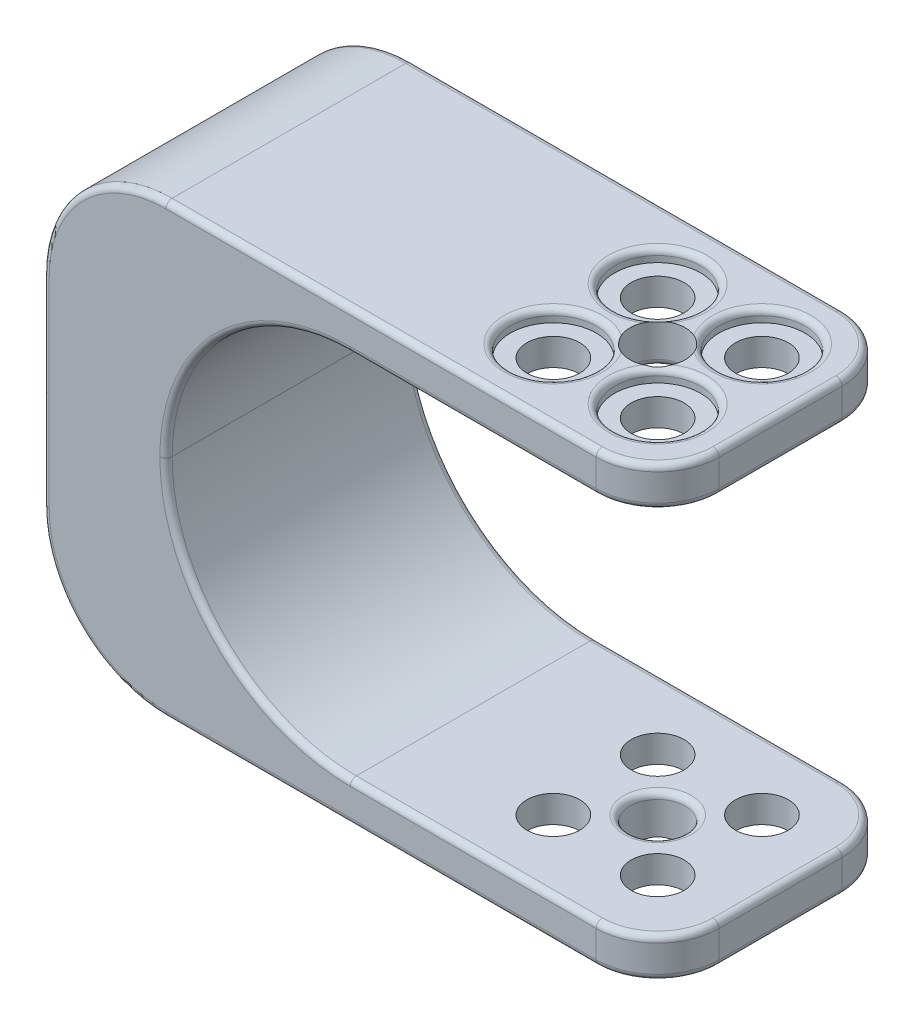
from build123d import *

# Parameters (mm, degrees)
SKETCH1_W           = 50
SKETCH1_H           = 20
SKETCH1_R           = 2.25
SKETCH1_R_2         = 2.15
BOSS_EXTRUDE1_DEPTH = 36.4
CUT_EXTRUDE1_DEPTH  = 36.4
SKETCH4_R           = 3.5
CUT_EXTRUDE2_DEPTH  = 1
FILLET1_R           = 0.5
FILLET2_R           = 0.5
CUT_EXTRUDE3_START  = -1
SKETCH6_R           = 3.5
CUT_EXTRUDE3_DEPTH  = 1
FILLET3_R           = 0.5
FILLET4_R           = 5
FILLET5_R           = 0.5


with BuildPart() as part:
    # Sketch1 → Boss-Extrude1 (new body)
    with BuildSketch(Plane(origin=(0, 0, 0), x_dir=(1, 0, 0), z_dir=(0, 1, 0))):
        with Locations((19.228797112, -4.608905713)):
            Rectangle(SKETCH1_W, SKETCH1_H)
        with Locations(Location((34.228797112, -4.608905713, 0), (0, 0, 270))):
            Circle(SKETCH1_R, mode=Mode.SUBTRACT)
        with Locations(Location((38.471437799, -8.8515464, 0), (0, 0, 270))):
            Circle(SKETCH1_R_2, mode=Mode.SUBTRACT)
        with Locations(Location((29.986156424, -8.8515464, 0), (0, 0, 270))):
            Circle(SKETCH1_R_2, mode=Mode.SUBTRACT)
        with Locations(Location((29.986156424, -0.366265025, 0), (0, 0, 270))):
            Circle(SKETCH1_R_2, mode=Mode.SUBTRACT)
        with Locations(Location((38.471437799, -0.366265025, 0), (0, 0, 270))):
            Circle(SKETCH1_R_2, mode=Mode.SUBTRACT)
    extrude(amount=BOSS_EXTRUDE1_DEPTH)

    # Sketch2 → Cut-Extrude1 (cut)
    with BuildSketch(Plane(origin=(0, 0, -5.391094287), x_dir=(-1, 0, 0), z_dir=(0, 0, -1))):
        with BuildLine():
            Line((-19.218797112, 33.2), (-44.228797112, 33.2))
            Line((-44.228797112, 33.2), (-44.228797112, 3.2))
            Line((-44.228797112, 3.2), (-19.218797112, 3.2))
            ThreePointArc((-19.218797112, 3.2), (-8.619266462, 7.59046935), (-4.228797112, 18.19))
            Line((-4.228797112, 18.19), (-4.228797112, 18.21))
            ThreePointArc((-4.228797112, 18.21), (-8.619266462, 28.80953065), (-19.218797112, 33.2))
        make_face()
        with BuildLine():
            Line((5.771202888, 36.4), (-4.228797112, 36.4))
            ThreePointArc((-4.228797112, 36.4), (2.8422707, 33.471067812), (5.771202888, 26.4))
            Line((5.771202888, 26.4), (5.771202888, 36.4))
        make_face()
        with BuildLine():
            ThreePointArc((5.771202888, 10), (2.8422707, 2.928932188), (-4.228797112, 0))
            Line((-4.228797112, 0), (5.771202888, 0))
            Line((5.771202888, 0), (5.771202888, 10))
        make_face()
    extrude(amount=-CUT_EXTRUDE1_DEPTH, mode=Mode.SUBTRACT)

    # Sketch4 → Cut-Extrude2 (cut)
    with BuildSketch(Plane.XZ):
        with Locations(Location((29.986156424, 8.8515464, 0), (0, 0, 270))):
            Circle(SKETCH4_R)
        with Locations(Location((38.471437799, 8.8515464, 0), (0, 0, 270))):
            Circle(SKETCH4_R)
        with Locations(Location((38.471437799, 0.366265025, 0), (0, 0, 270))):
            Circle(SKETCH4_R)
        with Locations(Location((29.986156424, 0.366265025, 0), (0, 0, 270))):
            Circle(SKETCH4_R)
    extrude(amount=-CUT_EXTRUDE2_DEPTH, mode=Mode.SUBTRACT)

    # Fillet1
    # the kernel refuses this fillet: 0.5 mm, written as the material it takes off along each edge
    with BuildSketch(Plane(origin=(29.986156424, 0, 8.8515464), x_dir=(0, 0, -1), z_dir=(-1, 0, 0))) as fillet1_piece_1:
        with BuildLine():
            CenterArc((3.5 + FILLET1_R, -FILLET1_R), FILLET1_R, 90, 90)
            Line((3.5, -FILLET1_R), (3.5, 0))
            Line((3.5, 0), (3.5 + FILLET1_R, 0))
        make_face()
    revolve(axis=Axis((29.986156424, 0, 8.8515464), (0, -1, 0)), mode=Mode.SUBTRACT)
    with BuildSketch(Plane(origin=(38.471437799, 0, 8.8515464), x_dir=(0, 0, -1), z_dir=(-1, 0, 0))) as fillet1_piece_2:
        with BuildLine():
            CenterArc((3.5 + FILLET1_R, -FILLET1_R), FILLET1_R, 90, 90)
            Line((3.5, -FILLET1_R), (3.5, 0))
            Line((3.5, 0), (3.5 + FILLET1_R, 0))
        make_face()
    revolve(axis=Axis((38.471437799, 0, 8.8515464), (0, -1, 0)), mode=Mode.SUBTRACT)
    with BuildSketch(Plane(origin=(38.471437799, 0, 0.366265025), x_dir=(0, 0, -1), z_dir=(-1, 0, 0))) as fillet1_piece_3:
        with BuildLine():
            CenterArc((3.5 + FILLET1_R, -FILLET1_R), FILLET1_R, 90, 90)
            Line((3.5, -FILLET1_R), (3.5, 0))
            Line((3.5, 0), (3.5 + FILLET1_R, 0))
        make_face()
    revolve(axis=Axis((38.471437799, 0, 0.366265025), (0, -1, 0)), mode=Mode.SUBTRACT)
    with BuildSketch(Plane(origin=(29.986156424, 0, 0.366265025), x_dir=(0, 0, -1), z_dir=(-1, 0, 0))) as fillet1_piece_4:
        with BuildLine():
            CenterArc((3.5 + FILLET1_R, -FILLET1_R), FILLET1_R, 90, 90)
            Line((3.5, -FILLET1_R), (3.5, 0))
            Line((3.5, 0), (3.5 + FILLET1_R, 0))
        make_face()
    revolve(axis=Axis((29.986156424, 0, 0.366265025), (0, -1, 0)), mode=Mode.SUBTRACT)
    with BuildSketch(Plane(origin=(34.228797112, 3.2, 4.608905713), x_dir=(0, 0, 1), z_dir=(1, 0, 0))) as fillet1_piece_5:
        with BuildLine():
            CenterArc((2.25 + FILLET1_R, FILLET1_R), FILLET1_R, 180, 90)
            Line((2.25, FILLET1_R), (2.25, 0))
            Line((2.25, 0), (2.25 + FILLET1_R, 0))
        make_face()
    revolve(axis=Axis((34.228797112, 3.2, 4.608905713), (0, -1, 0)), mode=Mode.SUBTRACT)

    # Fillet2
    fillet2_edges = [part.edges().sort_by_distance(p)[0] for p in [
        (34.228797112, 33.2, 2.358905713),
    ]]
    fillet(fillet2_edges, radius=FILLET2_R)

    # Sketch6 → Cut-Extrude3 (cut)
    with BuildSketch(Plane(origin=(0, 36.4, 0), x_dir=(1, 0, 0), z_dir=(0, 1, 0)).offset(CUT_EXTRUDE3_START)):
        with Locations(Location((29.986156424, -0.366265025, 0), (0, 0, 90))):
            Circle(SKETCH6_R)
        with Locations(Location((38.471437799, -0.366265025, 0), (0, 0, 90))):
            Circle(SKETCH6_R)
        with Locations(Location((38.471437799, -8.8515464, 0), (0, 0, 90))):
            Circle(SKETCH6_R)
        with Locations(Location((29.986156424, -8.8515464, 0), (0, 0, 90))):
            Circle(SKETCH6_R)
    extrude(amount=CUT_EXTRUDE3_DEPTH, mode=Mode.SUBTRACT)

    # Fillet3
    # the kernel refuses this fillet: 0.5 mm, written as the material it takes off along each edge
    with BuildSketch(Plane(origin=(29.986156424, 36.4, 0.366265025), x_dir=(0, 0, -1), z_dir=(1, 0, 0))) as fillet3_piece_1:
        with BuildLine():
            CenterArc((3.5 + FILLET3_R, -FILLET3_R), FILLET3_R, 90, 90)
            Line((3.5, -FILLET3_R), (3.5, 0))
            Line((3.5, 0), (3.5 + FILLET3_R, 0))
        make_face()
    revolve(axis=Axis((29.986156424, 36.4, 0.366265025), (0, 1, 0)), mode=Mode.SUBTRACT)
    with BuildSketch(Plane(origin=(38.471437799, 36.4, 0.366265025), x_dir=(0, 0, -1), z_dir=(1, 0, 0))) as fillet3_piece_2:
        with BuildLine():
            CenterArc((3.5 + FILLET3_R, -FILLET3_R), FILLET3_R, 90, 90)
            Line((3.5, -FILLET3_R), (3.5, 0))
            Line((3.5, 0), (3.5 + FILLET3_R, 0))
        make_face()
    revolve(axis=Axis((38.471437799, 36.4, 0.366265025), (0, 1, 0)), mode=Mode.SUBTRACT)
    with BuildSketch(Plane(origin=(38.471437799, 36.4, 8.8515464), x_dir=(0, 0, -1), z_dir=(1, 0, 0))) as fillet3_piece_3:
        with BuildLine():
            CenterArc((3.5 + FILLET3_R, -FILLET3_R), FILLET3_R, 90, 90)
            Line((3.5, -FILLET3_R), (3.5, 0))
            Line((3.5, 0), (3.5 + FILLET3_R, 0))
        make_face()
    revolve(axis=Axis((38.471437799, 36.4, 8.8515464), (0, 1, 0)), mode=Mode.SUBTRACT)
    with BuildSketch(Plane(origin=(29.986156424, 36.4, 8.8515464), x_dir=(0, 0, -1), z_dir=(1, 0, 0))) as fillet3_piece_4:
        with BuildLine():
            CenterArc((3.5 + FILLET3_R, -FILLET3_R), FILLET3_R, 90, 90)
            Line((3.5, -FILLET3_R), (3.5, 0))
            Line((3.5, 0), (3.5 + FILLET3_R, 0))
        make_face()
    revolve(axis=Axis((29.986156424, 36.4, 8.8515464), (0, 1, 0)), mode=Mode.SUBTRACT)

    # Fillet4
    fillet4_edges = [part.edges().sort_by_distance(p)[0] for p in [
        (44.228797112, 1.6, -5.391094287),
        (44.228797112, 1.6, 14.608905713),
        (44.228797112, 34.8, -5.391094287),
        (44.228797112, 34.8, 14.608905713),
    ]]
    fillet(fillet4_edges, radius=FILLET4_R)

    # Fillet5
    fillet5_edges = [part.edges().sort_by_distance(p)[0] for p in [
        (21.728797112, 36.4, -5.391094287),
        (29.223797112, 33.2, -5.391094287),
        (29.223797112, 3.2, -5.391094287),
        (21.728797112, 0, -5.391094287),
        (44.228797112, 0, 4.608905713),
        (42.764331018, 0, 13.144439619),
        (42.764331018, 0, -3.926628193),
        (44.228797112, 3.2, 4.608905713),
        (29.223797112, 3.2, 14.608905713),
        (42.764331018, 3.2, 13.144439619),
        (42.764331018, 3.2, -3.926628193),
        (29.223797112, 33.2, 14.608905713),
        (44.228797112, 33.2, 4.608905713),
        (44.228797112, 36.4, 4.608905713),
        (42.764331018, 33.2, -3.926628193),
        (42.764331018, 33.2, 13.144439619),
        (42.764331018, 36.4, -3.926628193),
        (42.764331018, 36.4, 13.144439619),
        (8.619266462, 28.80953065, -5.391094287),
        (4.228797112, 18.2, -5.391094287),
        (8.619266462, 7.59046935, -5.391094287),
        (8.619266462, 28.80953065, 14.608905713),
        (4.228797112, 18.2, 14.608905713),
        (8.619266462, 7.59046935, 14.608905713),
        (-5.771202888, 18.2, -5.391094287),
        (21.728797112, 36.4, 14.608905713),
        (-5.771202888, 18.2, 14.608905713),
        (21.728797112, 0, 14.608905713),
        (-2.8422707, 33.471067812, 14.608905713),
        (-2.8422707, 33.471067812, -5.391094287),
        (-2.8422707, 2.928932188, -5.391094287),
        (-2.8422707, 2.928932188, 14.608905713),
    ]]
    fillet(fillet5_edges, radius=FILLET5_R)


solid = part.part
